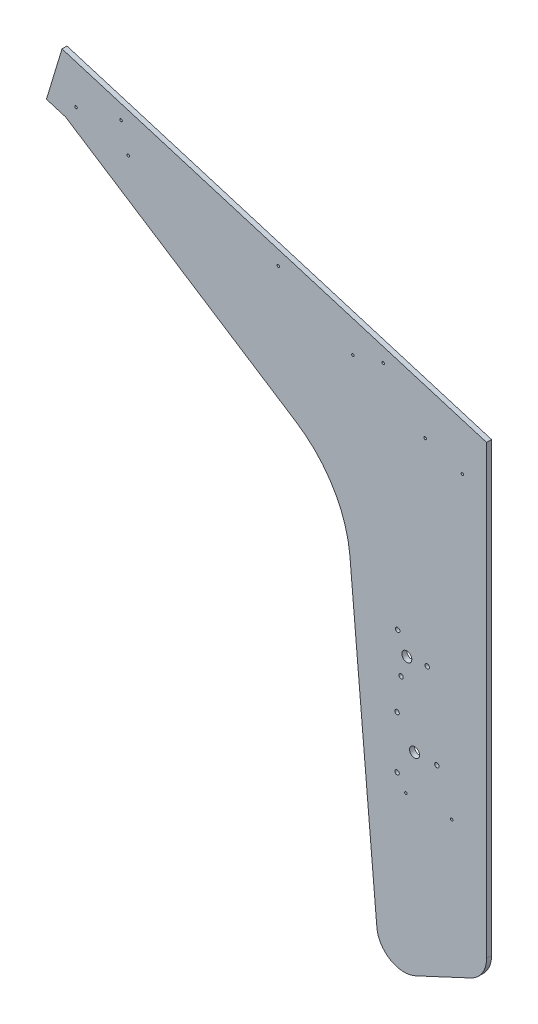
from build123d import *

# Parameters (mm, degrees)
BOSS_EXTRUDE1_DEPTH    = 6.35
F_10_CLEARANCE_HOLE1_D = 5.6134
SKETCH2_R              = 6.35
CUT_EXTRUDE1_DEPTH     = 595.969799783
HOLE1_D                = 3.175
HOLE1_DEPTH            = 31.75
HOLE1_CSINK_D          = 10.16
HOLE1_CSINK_ANGLE      = 82
HOLE1_TIP              = 0.953866233


with BuildPart() as part:
    # Sketch1 → Boss-Extrude1 (new body)
    with BuildSketch(Plane.XY):
        with BuildLine():
            Line((-35.929687435, 42.153790719), (-1.51387348, -351.220762831))
            ThreePointArc((-1.51387348, -351.220762831), (15.815726351, -378.422785743), (48.038169143, -379.829647978))
            Line((48.038169143, -379.829647978), (118.213861049, -347.106185426))
            ThreePointArc((118.213861049, -347.106185426), (132.909364503, -334.218574785), (138.378918258, -315.453385964))
            Line((138.378918258, -315.453385964), (138.378918258, 254.538122714))
            Line((138.378918258, 254.538122714), (-403.099057101, 418.419278389))
            Line((-403.099057101, 418.419278389), (-422.935039487, 352.879420938))
            Line((-422.935039487, 352.879420938), (-398.624090476, 345.521584423))
            Line((-398.624090476, 345.521584423), (-105.026598758, 156.030008008))
            ThreePointArc((-105.026598758, 156.030008008), (-57.378429325, 107.040440177), (-35.929687435, 42.153790719))
        make_face()
    extrude(amount=BOSS_EXTRUDE1_DEPTH)

    # #10 Clearance Hole1 (through all)
    with Locations(Plane(origin=(0, 0, 0), x_dir=(-1, 0, 0), z_dir=(0, 0, -1))):
        with Locations((-24.251683892, -100.351877226), (-24.251683892, -167.026877226), (-75.051683892, -133.689377226), (-29.317369668, -58.274702428), (-25.026257572, -9.227066735), (-62.648775204, -30.647052627)):
            Hole(F_10_CLEARANCE_HOLE1_D / 2)

    # Sketch2 → Cut-Extrude1 (cut, through all)
    with BuildSketch(Plane(origin=(0, 0, 0), x_dir=(-1, 0, 0), z_dir=(0, 0, -1))):
        with Locations((-46.476683892, -133.689377226)):
            Circle(SKETCH2_R)
        with Locations((-36.66056812, -32.920726132)):
            Circle(SKETCH2_R)
    extrude(amount=-CUT_EXTRUDE1_DEPTH, mode=Mode.SUBTRACT)

    # Hole1
    with Locations(Plane(origin=(280.965656834, -208.178972459, 12.7), x_dir=(-0.08995962873759125, 0.9959454127598535, 0), z_dir=(0, 0, 1))):
        with Locations((637.870011036, 553.595098153), (45.881126628, 242.392089332), (40.618488347, 184.129282685), (426.147796322, 135.556957951), (446.355227241, 181.492197901), (500.172575608, 269.166288689), (628.775118598, 612.059238147), (602.701030232, 547.523604816), (559.371199386, 359.303721429), (507.038658286, 229.776136946)):
            CounterSinkHole(HOLE1_D / 2, HOLE1_CSINK_D / 2, depth=HOLE1_DEPTH, counter_sink_angle=HOLE1_CSINK_ANGLE)
            with Locations((0, 0, -(HOLE1_DEPTH + HOLE1_TIP / 2))):  # 118° drill point
                Cone(0, HOLE1_D / 2, HOLE1_TIP, mode=Mode.SUBTRACT)


solid = part.part
